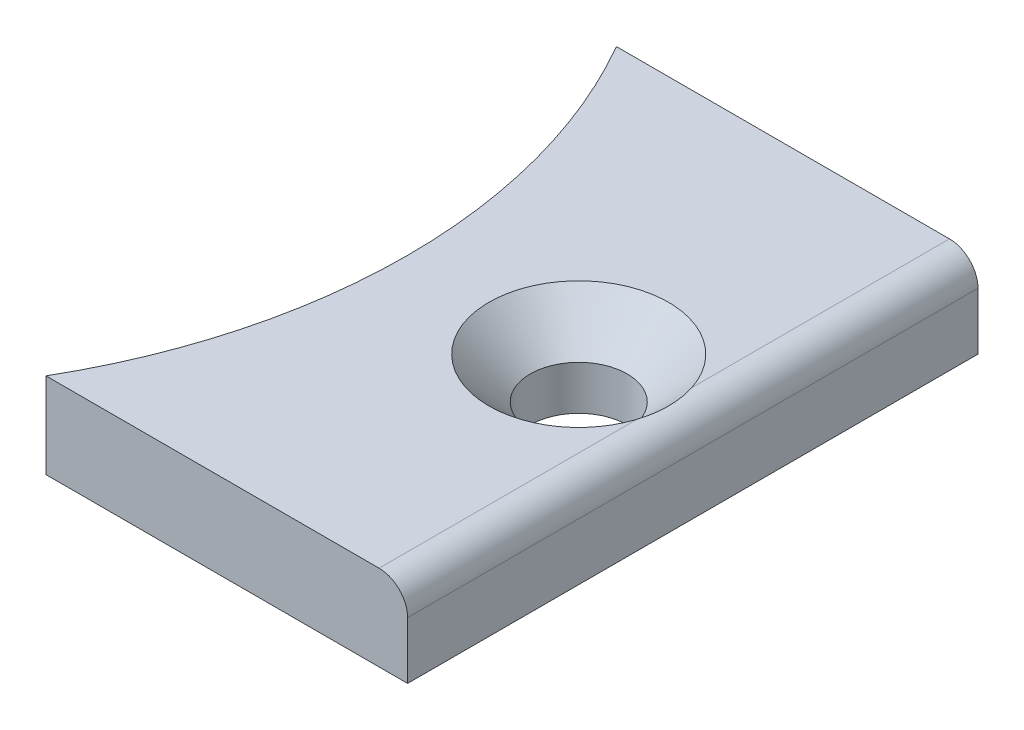
from build123d import *

# Parameters (mm, degrees)
BOSS_EXTRU_1_DEPTH = 3
CONG_1_R           = 1


with BuildPart() as part:
    # Esquisse1 → Boss.-Extru.1 (new body)
    with BuildSketch(Plane(origin=(0, 0, 0), x_dir=(1, 0, 0), z_dir=(0, 1, 0))):
        with BuildLine():
            Line((0, 10), (0, -10))
            Line((0, -10), (-12.679491924, -10))
            ThreePointArc((-12.679491924, -10), (-10, 0), (-12.679491924, 10))
            Line((-12.679491924, 10), (0, 10))
        make_face()
    extrude(amount=BOSS_EXTRU_1_DEPTH)

    # Esquisse3 → Fraisage pour vis à tête fraisée M31 (revolve, cut)
    with BuildSketch(Plane(origin=(-4, 3, 0), x_dir=(0, 0, 1), z_dir=(1, 0, 0))):
        Polygon((0, 0), (0, 3), (1.7, 3), (1.7, 1.45), (3.15, 0), align=None)
    revolve(axis=Axis((-4, 9.35, 0), (0, -1, 0)), mode=Mode.SUBTRACT)

    # Congé1
    # the kernel refuses this fillet: 1 mm, written as the material it takes off along each edge
    with BuildSketch(Plane(origin=(0, 3, -12.5), x_dir=(0, -1, 0), z_dir=(0, 0, 1))) as cong_1_piece_1:
        with BuildLine():
            CenterArc((CONG_1_R, -CONG_1_R), CONG_1_R, 90, 90)
            Line((0, -CONG_1_R), (0, 0))
            Line((0, 0), (CONG_1_R, 0))
        make_face()
    extrude(amount=25, mode=Mode.SUBTRACT)


solid = part.part
